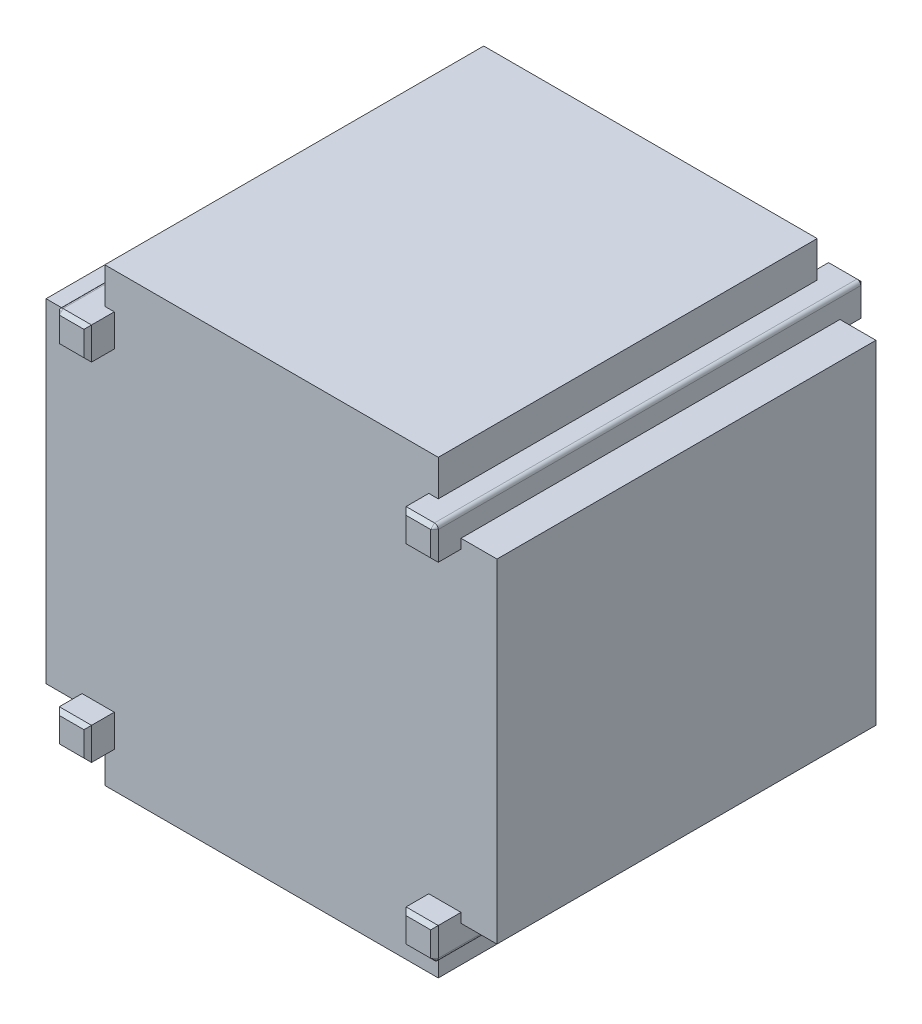
from build123d import *

# Parameters (mm, degrees)
BOSS_EXTRUDE1_DEPTH        = 56.75
BOSS_EXTRUDE1_DEPTH_BACK   = 56.75
SKETCH1_W                  = 8.5
SKETCH1_H                  = 8.5
BOSS_EXTRUDE1_2_DEPTH      = 56.75
BOSS_EXTRUDE1_2_DEPTH_BACK = 56.75
BOSS_EXTRUDE1_3_DEPTH      = 56.75
BOSS_EXTRUDE1_3_DEPTH_BACK = 56.75
BOSS_EXTRUDE1_4_DEPTH      = 56.75
BOSS_EXTRUDE1_4_DEPTH_BACK = 56.75
BOSS_EXTRUDE2_DEPTH        = 49.75
BOSS_EXTRUDE2_DEPTH_BACK   = 50.25
FILLET1_R                  = 1
CHAMFER2_SIZE              = 1


with BuildPart() as part:
    # Sketch1 → Boss-Extrude1 (new, two sides: drawn at the far end of the back side and taken through both)
    with BuildSketch(Plane.XY.offset(-BOSS_EXTRUDE1_DEPTH_BACK)):
        with Locations((-45.75, 45.75)):
            Rectangle(SKETCH1_W, SKETCH1_H)
    extrude(amount=BOSS_EXTRUDE1_DEPTH + BOSS_EXTRUDE1_DEPTH_BACK)



with BuildPart() as body_2:
    # Sketch1 → Boss-Extrude1 2 (new, two sides: drawn at the far end of the back side and taken through both)
    with BuildSketch(Plane.XY.offset(-BOSS_EXTRUDE1_2_DEPTH_BACK)):
        with Locations((45.75, 45.75)):
            Rectangle(SKETCH1_W, SKETCH1_H)
    extrude(amount=BOSS_EXTRUDE1_2_DEPTH + BOSS_EXTRUDE1_2_DEPTH_BACK)


with BuildPart() as body_3:
    # Sketch1 → Boss-Extrude1 3 (new, two sides: drawn at the far end of the back side and taken through both)
    with BuildSketch(Plane.XY.offset(-BOSS_EXTRUDE1_3_DEPTH_BACK)):
        with Locations((45.75, -45.75)):
            Rectangle(SKETCH1_W, SKETCH1_H)
    extrude(amount=BOSS_EXTRUDE1_3_DEPTH + BOSS_EXTRUDE1_3_DEPTH_BACK)


with BuildPart() as body_4:
    # Sketch1 → Boss-Extrude1 4 (new, two sides: drawn at the far end of the back side and taken through both)
    with BuildSketch(Plane.XY.offset(-BOSS_EXTRUDE1_4_DEPTH_BACK)):
        with Locations((-45.75, -45.75)):
            Rectangle(SKETCH1_W, SKETCH1_H)
    extrude(amount=BOSS_EXTRUDE1_4_DEPTH + BOSS_EXTRUDE1_4_DEPTH_BACK)


with BuildPart() as part_1:
    add(part.part)

    add(body_2.part)  # Boss-Extrude2 merges body 2

    add(body_3.part)  # Boss-Extrude2 merges body 3

    add(body_4.part)  # Boss-Extrude2 merges body 4
    # Sketch2 → Boss-Extrude2 (add, two sides: drawn at the far end of the back side and taken through both)
    with BuildSketch(Plane.XY.offset(-BOSS_EXTRUDE2_DEPTH_BACK)):
        Polygon((-44, 50), (-44, 59.5), (44, 59.5), (44, 50), (50, 50), (50, 44), (59.5, 44), (59.5, -44), (50, -44), (50, -50), (44, -50), (44, -59.5), (-44, -59.5), (-44, -50), (-50, -50), (-50, -44), (-59.5, -44), (-59.5, 44), (-50, 44), (-50, 50), align=None)
    extrude(amount=BOSS_EXTRUDE2_DEPTH + BOSS_EXTRUDE2_DEPTH_BACK)

    # Fillet1
    fillet1_edges = [part_1.edges().sort_by_distance(p)[0] for p in [
        (-50, -50, 0),
        (50, 50, 0),
        (50, -50, 0),
        (-50, 50, 0),
    ]]
    fillet(fillet1_edges, radius=FILLET1_R)

    # Chamfer2
    chamfer2_edges = [part_1.edges().sort_by_distance(p)[0] for p in [
        (-45.75, -41.5, 56.75),
        (-41.5, -45.75, 56.75),
        (-45.25, -50, 56.75),
        (-49.707106781, -49.707106781, 56.75),
        (-50, -45.25, 56.75),
        (41.5, -45.75, 56.75),
        (45.75, -41.5, 56.75),
        (45.75, 41.5, 56.75),
        (41.5, 45.75, 56.75),
        (45.25, 50, 56.75),
        (49.707106781, 49.707106781, 56.75),
        (50, 45.25, 56.75),
        (-41.5, 45.75, 56.75),
        (-45.75, 41.5, 56.75),
        (41.5, 45.75, -56.75),
        (45.75, 41.5, -56.75),
        (50, 45.25, -56.75),
        (49.707106781, 49.707106781, -56.75),
        (45.25, 50, -56.75),
        (-45.75, 41.5, -56.75),
        (-41.5, 45.75, -56.75),
        (-41.5, -45.75, -56.75),
        (-45.75, -41.5, -56.75),
        (-50, -45.25, -56.75),
        (-49.707106781, -49.707106781, -56.75),
        (-45.25, -50, -56.75),
        (45.75, -41.5, -56.75),
        (41.5, -45.75, -56.75),
        (45.25, -50, 56.75),
        (50, -45.25, 56.75),
        (-45.25, 50, 56.75),
        (-50, 45.25, 56.75),
        (-45.25, 50, -56.75),
        (-50, 45.25, -56.75),
        (45.25, -50, -56.75),
        (50, -45.25, -56.75),
        (49.707106781, -49.707106781, 56.75),
        (-49.707106781, 49.707106781, 56.75),
        (-49.707106781, 49.707106781, -56.75),
        (49.707106781, -49.707106781, -56.75),
    ]]
    chamfer(chamfer2_edges, length=CHAMFER2_SIZE)


solid = part_1.part
